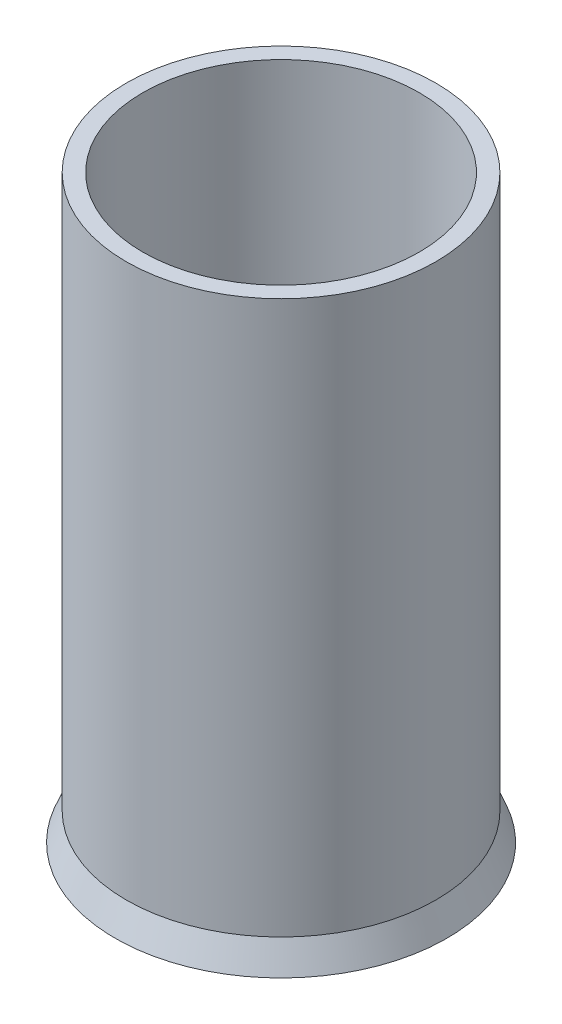
from build123d import *

# Parameters (mm, degrees)
SKETCH_1_R      = 28
SKETCH_1_R_2    = 25
EXTRUDE_1_DEPTH = 100
SKETCH_2_R      = 30
EXTRUDE_2_DEPTH = 5


with BuildPart() as part:
    # 草图1 → 凸台-拉伸1 (new body)
    with BuildSketch(Plane(origin=(0, 0, 0), x_dir=(1, 0, 0), z_dir=(0, 1, 0))):
        with Locations(Location((0, 0, 0), (0, 0, 270))):
            Circle(SKETCH_1_R)
        with Locations(Location((0, 0, 0), (0, 0, 270))):
            Circle(SKETCH_1_R_2, mode=Mode.SUBTRACT)
    extrude(amount=EXTRUDE_1_DEPTH)

    # 草图2 → 凸台-拉伸2 (add)
    with BuildSketch(Plane.XZ):
        with Locations(Location((0, 0, 0), (0, 0, 270))):
            Circle(SKETCH_2_R)
    extrude(amount=EXTRUDE_2_DEPTH)

    # 倒角3: read off the stored shape, not the designer's step
    # 倒角3 outline → 倒角3 (revolve, cut)
    with BuildSketch(Plane.XY):
        Polygon((30, 0), (28, 0), (30, -5), align=None)
    revolve(axis=Axis((0, 0, 0), (0, 1, 0)), mode=Mode.SUBTRACT)


solid = part.part
